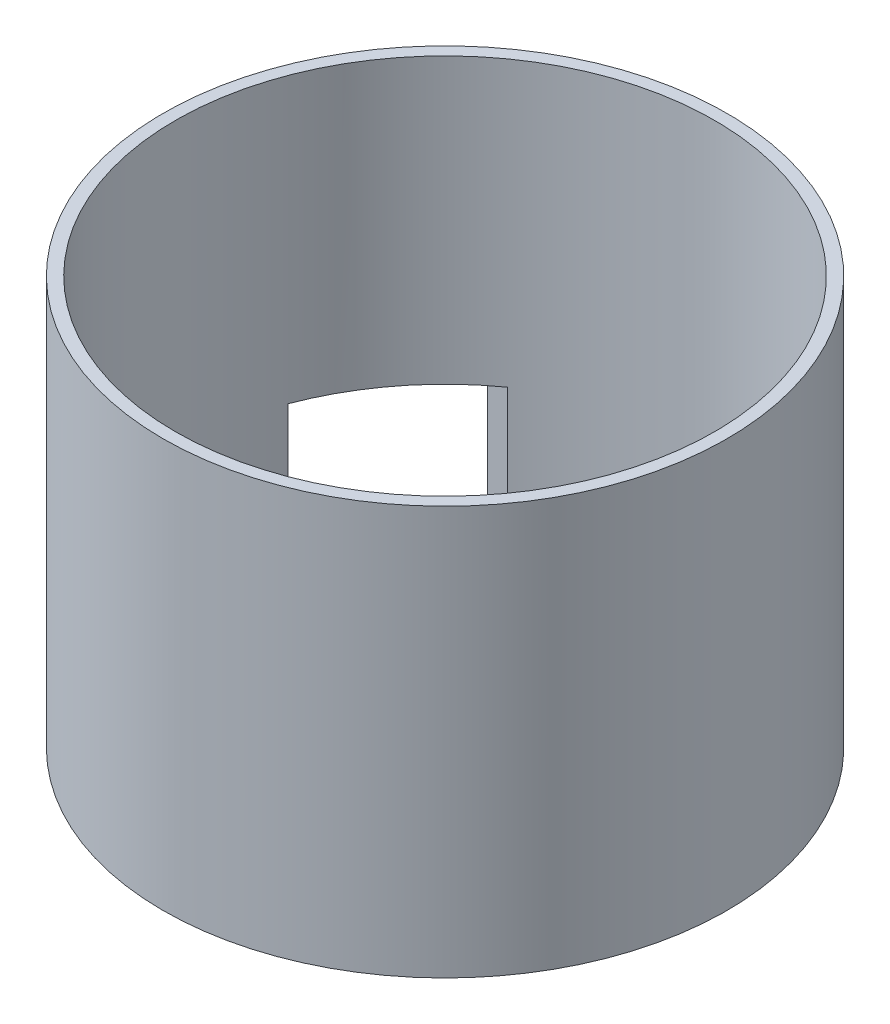
from build123d import *

# Parameters (mm, degrees)
SKETCH1_R           = 69
SKETCH1_R_2         = 66
BOSS_EXTRUDE1_DEPTH = 100
CUT_EXTRUDE1_REACH  = 200.784
SKETCH3_W           = 20
SKETCH3_H           = 28
FILLET1_R           = 3
SKETCH4_W           = 30.4
SKETCH4_H           = 30.4
CUT_EXTRUDE2_DEPTH  = 140.721151039


with BuildPart() as part:
    # Sketch1 → Boss-Extrude1 (new body)
    with BuildSketch(Plane(origin=(0, 0, 0), x_dir=(1, 0, 0), z_dir=(0, 1, 0))):
        Circle(SKETCH1_R)
        Circle(SKETCH1_R_2, mode=Mode.SUBTRACT)
    extrude(amount=BOSS_EXTRUDE1_DEPTH)

    # Sketch3 → Cut-Extrude1 (cut, up to next)
    with BuildSketch(Plane(origin=(-62.177817942, 0, 41.93946776), x_dir=(-0.5591929034707485, 0, -0.8290375725550407), z_dir=(0.8290375725550406, 0, -0.5591929034707483)), mode=Mode.PRIVATE) as cut_extrude1_sk1:
        with Locations((0, 52.5)):
            Rectangle(SKETCH3_W, SKETCH3_H)
    cut_extrude1_tool1 = extrude(cut_extrude1_sk1.sketch, amount=CUT_EXTRUDE1_REACH, mode=Mode.PRIVATE) & part.part
    add(cut_extrude1_tool1.solids().sort_by_distance((-62.177818, 52.5, 41.939468))[0], mode=Mode.SUBTRACT)

    # Fillet1
    fillet1_edges = [part.edges().sort_by_distance(p)[0] for p in [
        (-49.750284469, 38.5, 45.619170075),
        (-60.934142538, 38.5, 29.038418624),
        (-49.750284469, 66.5, 45.619170075),
        (-60.934142538, 66.5, 29.038418624),
    ]]
    fillet(fillet1_edges, radius=FILLET1_R)

    # Sketch4 → Cut-Extrude2 (cut, through all)
    with BuildSketch(Plane(origin=(0, 0, 0), x_dir=(0, 0, -1), z_dir=(1, 0, 0))):
        with Locations((38.5, 15.2)):
            Rectangle(SKETCH4_W, SKETCH4_H)
    extrude(amount=-CUT_EXTRUDE2_DEPTH, mode=Mode.SUBTRACT)


solid = part.part
